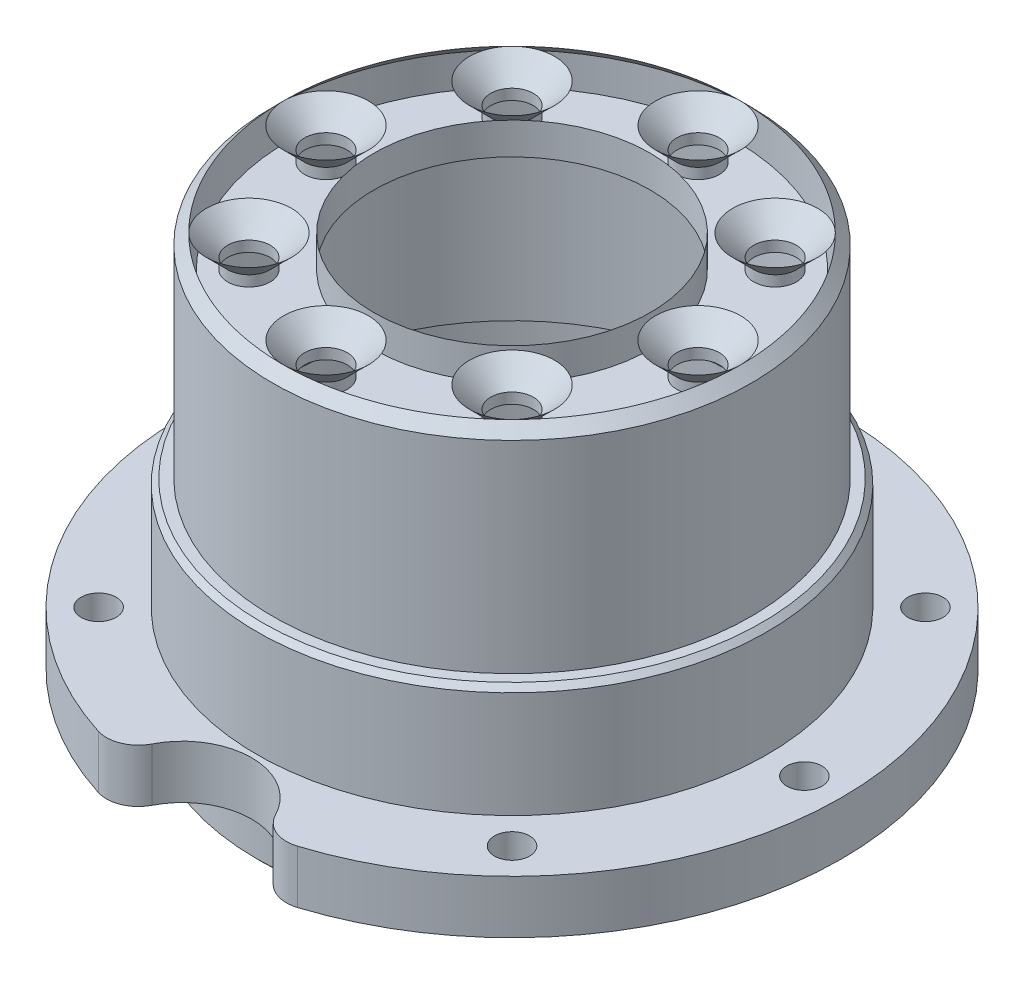
from build123d import *

# Parameters (mm, degrees)
HOLE_WIZARD_M4_1_D        = 3.3
HOLE_WIZARD_1_D           = 4
HOLE_WIZARD_1_CSINK_D     = 8
HOLE_WIZARD_1_CSINK_ANGLE = 90
CHAMFER_1_SIZE            = 0.5
CUT_EXTRUDE_START         = -5
CUT_EXTRUDE_1_OUTLINE_R   = 1.65
CUT_EXTRUDE_1_DEPTH       = 5
FILLET_1_R                = 3


# Read off the part's stored shape, not the designer's step: 切除-拉伸1
with BuildPart() as part:
    # 草图1 → 旋转1 (revolve)
    with BuildSketch(Plane.XY, mode=Mode.PRIVATE) as revolve_1_sk:
        Polygon((-22.5, 35.5), (-13, 35.5), (-13, 32.5), (-21, 32.5), (-21, 13.5), (-22, 13.5), (-22, -4), (-24, -4), (-24, 0), (-31, 0), (-31, 5), (-24, 5), (-24, 15.5), (-22.5, 15.5), align=None)
    revolve(revolve_1_sk.sketch.rotate(Axis((0, 0, 0), (0, 1, 0)), 270), axis=Axis((0, 0, 0), (0, 1, 0)))

    # M4 螺纹孔1 (through all)
    with Locations(Plane(origin=(0, 5, 0), x_dir=(1, 0, 0), z_dir=(0, 1, 0))):
        with Locations((-19.445436483, 19.445436483), (0, 27.5), (19.445436483, 19.445436483), (27.5, 0), (19.445436483, -19.445436483), (0, -27.5), (-19.445436483, -19.445436483), (-27.5, 0)):
            Hole(HOLE_WIZARD_M4_1_D / 2)

    # 孔1 (through all)
    with Locations(Plane(origin=(0, 35.5, 0), x_dir=(1, 0, 0), z_dir=(0, 1, 0))):
        with Locations((0, 17.5), (12.374368671, 12.374368671), (17.5, 0), (12.374368671, -12.374368671), (0, -17.5), (-12.374368671, -12.374368671), (-17.5, 0), (-12.374368671, 12.374368671)):
            CounterSinkHole(HOLE_WIZARD_1_D / 2, HOLE_WIZARD_1_CSINK_D / 2, counter_sink_angle=HOLE_WIZARD_1_CSINK_ANGLE)

    # 倒角1
    chamfer_1_edges = [part.edges().sort_by_distance(p)[0] for p in [
        (0, -4, 24),
        (0, 15.5, 24),
    ]]
    chamfer(chamfer_1_edges, length=CHAMFER_1_SIZE)

    # 切除-拉伸1 outline → 切除-拉伸1 (cut)
    with BuildSketch(Plane(origin=(0, 5, 0), x_dir=(1, 0, 0), z_dir=(0, 1, 0)).offset(CUT_EXTRUDE_START)):
        with BuildLine():
            ThreePointArc((-6.464180048, -30.318548387), (0, -31), (6.464180048, -30.318548387))
            ThreePointArc((6.464180048, -30.318548387), (0, -24.5), (-6.464180048, -30.318548387))
        make_face()
        with Locations((0, -27.5)):
            Circle(CUT_EXTRUDE_1_OUTLINE_R, mode=Mode.SUBTRACT)
    extrude(amount=CUT_EXTRUDE_1_DEPTH, mode=Mode.SUBTRACT)

    # Cut-Extrude 1 2 outline → Cut-Extrude 1 2 (revolve, cut)
    with BuildSketch(Plane.XY):
        Polygon((22.5, 35.5), (21.5, 35.5), (22.5, 34.5), align=None)
    revolve(axis=Axis((0, 0, 0), (0, 1, 0)), mode=Mode.SUBTRACT)

    # 圆角1
    fillet_1_edges = [part.edges().sort_by_distance(p)[0] for p in [
        (-6.464180048, 2.5, 30.318548387),
        (6.464180048, 2.5, 30.318548387),
    ]]
    fillet(fillet_1_edges, radius=FILLET_1_R)


solid = part.part
